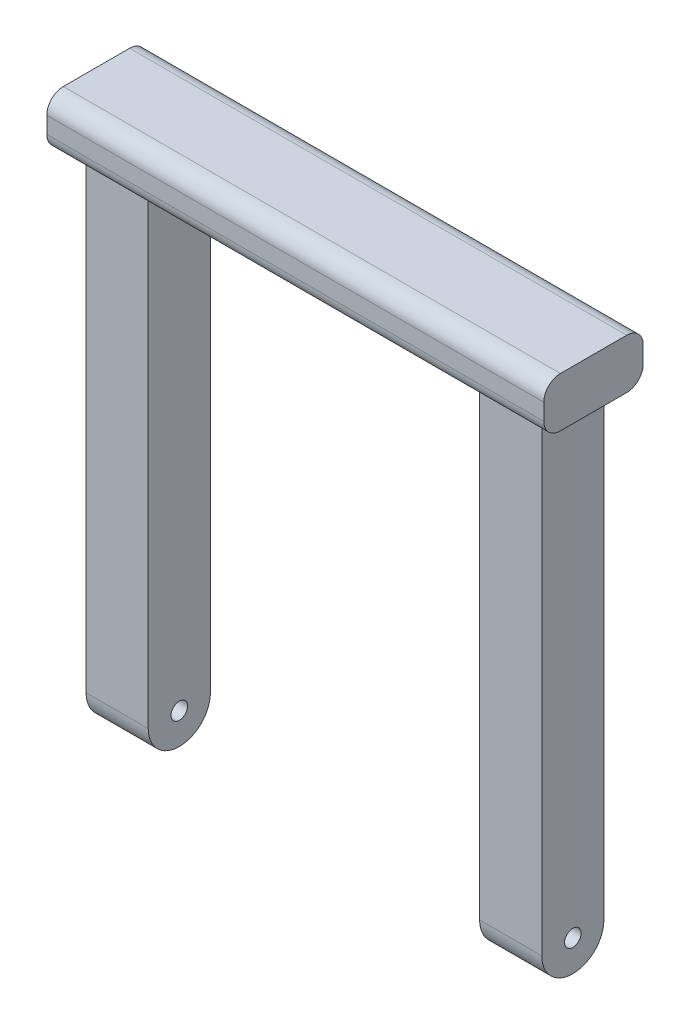
from build123d import *

# Parameters (mm, degrees)
SKETCH1_W           = 152.4
SKETCH1_H           = 30.48
BOSS_EXTRUDE1_DEPTH = 15.24
SKETCH2_W           = 19.05
SKETCH2_H           = 19.05
BOSS_EXTRUDE2_DEPTH = 152.4
SKETCH3_R           = 2.54
CUT_EXTRUDE1_DEPTH  = 214.273047758
FILLET1_R           = 9.525
FILLET2_R           = 9.525
FILLET3_R           = 9.525
FILLET4_R           = 9.525
FILLET5_R           = 5.08
FILLET6_R           = 5.08
FILLET7_R           = 5.08
FILLET8_R           = 5.08


with BuildPart() as part:
    # Sketch1 → Boss-Extrude1 (new body)
    with BuildSketch(Plane(origin=(0, 0, 0), x_dir=(1, 0, 0), z_dir=(0, 1, 0))):
        with Locations((76.2, 15.24)):
            Rectangle(SKETCH1_W, SKETCH1_H)
    extrude(amount=BOSS_EXTRUDE1_DEPTH)

    # Sketch2 → Boss-Extrude2 (add)
    with BuildSketch(Plane.XZ):
        with Locations((136.525, -15.24)):
            Rectangle(SKETCH2_W, SKETCH2_H)
        with Locations((15.875, -15.24)):
            Rectangle(SKETCH2_W, SKETCH2_H)
    extrude(amount=BOSS_EXTRUDE2_DEPTH)

    # Sketch3 → Cut-Extrude1 (cut, through all)
    with BuildSketch(Plane.ZY.offset(-6.35)):
        with Locations((-15.24, -142.875)):
            Circle(SKETCH3_R)
    extrude(amount=-CUT_EXTRUDE1_DEPTH, mode=Mode.SUBTRACT)

    # Fillet1
    fillet1_edges = [part.edges().sort_by_distance(p)[0] for p in [
        (15.875, -152.4, -5.715),
    ]]
    fillet(fillet1_edges, radius=FILLET1_R)

    # Fillet2
    fillet2_edges = [part.edges().sort_by_distance(p)[0] for p in [
        (15.875, -152.4, -24.765),
    ]]
    fillet(fillet2_edges, radius=FILLET2_R - 0.0001)  # a hair under: the kernel refuses the full size

    # Fillet3
    fillet3_edges = [part.edges().sort_by_distance(p)[0] for p in [
        (136.525, -152.4, -24.765),
    ]]
    fillet(fillet3_edges, radius=FILLET3_R)

    # Fillet4
    fillet4_edges = [part.edges().sort_by_distance(p)[0] for p in [
        (136.525, -152.4, -5.715),
    ]]
    fillet(fillet4_edges, radius=FILLET4_R - 0.0001)  # a hair under: the kernel refuses the full size

    # Fillet5
    fillet5_edges = [part.edges().sort_by_distance(p)[0] for p in [
        (76.2, 15.24, 0),
    ]]
    fillet(fillet5_edges, radius=FILLET5_R)

    # Fillet6
    fillet6_edges = [part.edges().sort_by_distance(p)[0] for p in [
        (76.2, 0, 0),
    ]]
    fillet(fillet6_edges, radius=FILLET6_R)

    # Fillet7
    fillet7_edges = [part.edges().sort_by_distance(p)[0] for p in [
        (76.2, 0, -30.48),
    ]]
    fillet(fillet7_edges, radius=FILLET7_R)

    # Fillet8
    fillet8_edges = [part.edges().sort_by_distance(p)[0] for p in [
        (76.2, 15.24, -30.48),
    ]]
    fillet(fillet8_edges, radius=FILLET8_R)


solid = part.part
